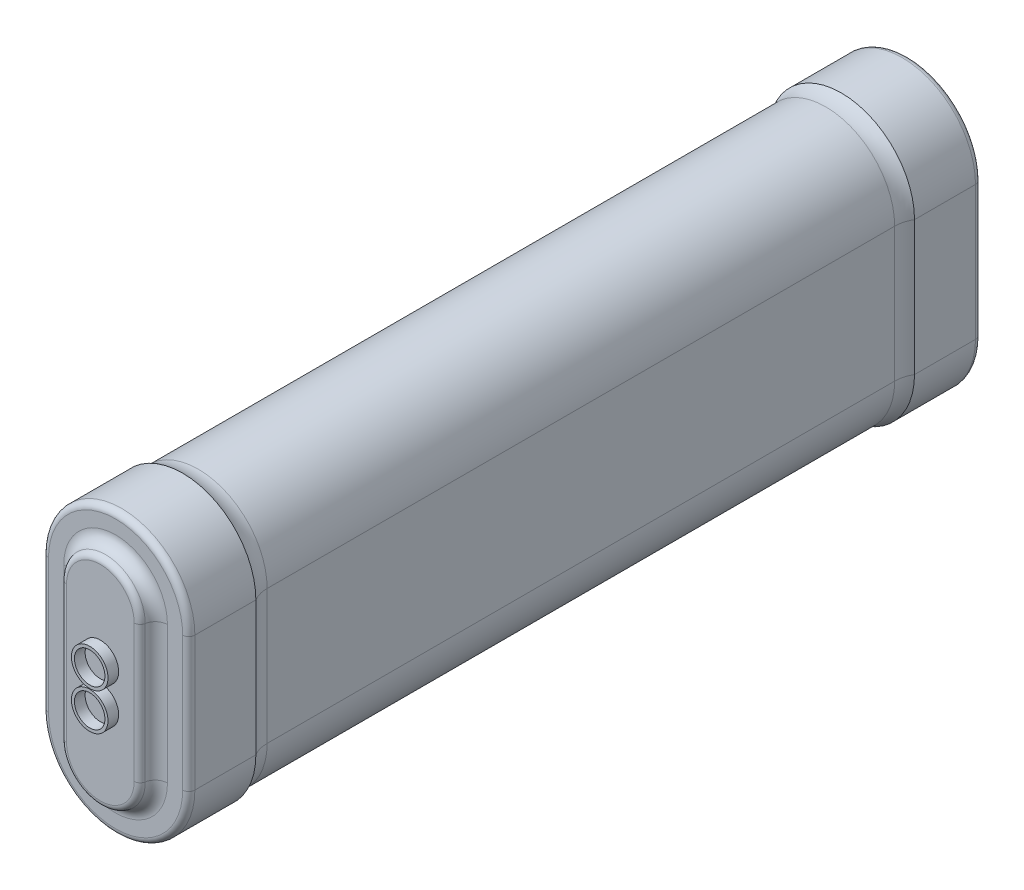
from build123d import *

# Parameters (mm, degrees)
BOSS_EXTRUDE2_DEPTH = 65
CUT_EXTRUDE1_DEPTH  = 54
FILLET1_R           = 5
FILLET2_R           = 1
BOSS_EXTRUDE3_DEPTH = 2.5
FILLET4_R           = 2
FILLET5_R           = 1
SKETCH4_R           = 3
SKETCH4_R_2         = 2.5
BOSS_EXTRUDE8_DEPTH = 1.75


with BuildPart() as part:
    # Sketch1 → Boss-Extrude2 (new, symmetric)
    with BuildSketch(Plane.XY):
        with BuildLine():
            Line((-12, -11), (-12, 11))
            ThreePointArc((-12, 11), (0, 23), (12, 11))
            Line((12, 11), (12, -11))
            ThreePointArc((12, -11), (0, -23), (-12, -11))
        make_face()
    extrude(amount=BOSS_EXTRUDE2_DEPTH, both=True)

    # Sketch2 → Cut-Extrude1 (cut, symmetric)
    with BuildSketch(Plane.XY):
        with BuildLine():
            Line((15, 11), (15, -11))
            ThreePointArc((15, -11), (0, -26), (-15, -11))
            Line((-15, -11), (-15, 11))
            ThreePointArc((-15, 11), (0, 26), (15, 11))
        make_face()
        with BuildLine():
            Line((-11.3, 11), (-11.3, -11))
            ThreePointArc((-11.3, -11), (0, -22.3), (11.3, -11))
            Line((11.3, -11), (11.3, 11))
            ThreePointArc((11.3, 11), (0, 22.3), (-11.3, 11))
        make_face(mode=Mode.SUBTRACT)
    extrude(amount=CUT_EXTRUDE1_DEPTH, both=True, mode=Mode.SUBTRACT)

    # Fillet1
    # the kernel refuses this fillet: 5 mm, written as the material it adds along each edge
    with BuildSketch(Plane(origin=(0, 11, -54), x_dir=(1, 0, 0), z_dir=(0, -1, 0))) as fillet1_piece_1:
        with BuildLine():
            CenterArc((16.3, 2.551470164), FILLET1_R, 180, 30.683417109)
            Line((11.3, 2.551470164), (11.2, 2.551470164))
            Line((11.2, 2.551470164), (11.2, 0))
            Line((11.2, 0), (11.3, -0.1))
            ThreePointArc((11.3, -0.1), (11.65, -0.1), (11.914, -0.051029403))
            Line((11.914, -0.051029403), (12, 0))
        make_face()
    revolve(axis=Axis((0, 11, -54), (0, 0, 1)), revolution_arc=180)
    with BuildSketch(Plane(origin=(-11.3, 11, -54), x_dir=(-1, 0, 0), z_dir=(0, -1, 0)), Plane(origin=(11.3, -11, -54), x_dir=(1, 0, 0), z_dir=(0, 1, 0))) as fillet1_piece_2:
        with BuildLine():
            CenterArc((5, -2.551470164), FILLET1_R, 149.316582891, 30.683417109)
            Line((0, -2.551470164), (-0.1, -2.551470164))
            Line((-0.1, -2.551470164), (-0.1, 0))
            Line((-0.1, 0), (0, 0.1))
            ThreePointArc((0, 0.1), (0.35, 0.1), (0.614, 0.051029403))
            Line((0.614, 0.051029403), (0.7, 0))
        make_face()
    extrude(amount=22)
    with BuildSketch(Plane(origin=(0, -11, -54), x_dir=(-1, 0, 0), z_dir=(0, 1, 0))) as fillet1_piece_3:
        with BuildLine():
            CenterArc((16.3, 2.551470164), FILLET1_R, 180, 30.683417109)
            Line((11.3, 2.551470164), (11.2, 2.551470164))
            Line((11.2, 2.551470164), (11.2, 0))
            Line((11.2, 0), (11.3, -0.1))
            ThreePointArc((11.3, -0.1), (11.65, -0.1), (11.914, -0.051029403))
            Line((11.914, -0.051029403), (12, 0))
        make_face()
    revolve(axis=Axis((0, -11, -54), (0, 0, 1)), revolution_arc=180)
    with BuildSketch(Plane(origin=(0, 11, 54), x_dir=(1, 0, 0), z_dir=(0, -1, 0))) as fillet1_piece_4:
        with BuildLine():
            CenterArc((16.3, -2.551470164), FILLET1_R, 149.316582891, 30.683417109)
            Line((12, 0), (11.914, 0.051029403))
            ThreePointArc((11.914, 0.051029403), (11.65, 0.1), (11.3, 0.1))
            Line((11.3, 0.1), (11.2, 0))
            Line((11.2, 0), (11.2, -2.551470164))
            Line((11.2, -2.551470164), (11.3, -2.551470164))
        make_face()
    revolve(axis=Axis((0, 11, 54), (0, 0, 1)), revolution_arc=180)
    with BuildSketch(Plane(origin=(11.3, -11, 54), x_dir=(0, 0, -1), z_dir=(0, 1, 0)), Plane(origin=(-11.3, 11, 54), x_dir=(0, 0, -1), z_dir=(0, -1, 0))) as fillet1_piece_5:
        with BuildLine():
            CenterArc((2.551470164, -5), FILLET1_R, 90, 30.683417109)
            Line((0, -0.7), (-0.051029403, -0.614))
            ThreePointArc((-0.051029403, -0.614), (-0.1, -0.35), (-0.1, 0))
            Line((-0.1, 0), (0, 0.1))
            Line((0, 0.1), (2.551470164, 0.1))
            Line((2.551470164, 0.1), (2.551470164, 0))
        make_face()
    extrude(amount=22)
    with BuildSketch(Plane(origin=(0, -11, 54), x_dir=(-1, 0, 0), z_dir=(0, 1, 0))) as fillet1_piece_6:
        with BuildLine():
            CenterArc((16.3, -2.551470164), FILLET1_R, 149.316582891, 30.683417109)
            Line((12, 0), (11.914, 0.051029403))
            ThreePointArc((11.914, 0.051029403), (11.65, 0.1), (11.3, 0.1))
            Line((11.3, 0.1), (11.2, 0))
            Line((11.2, 0), (11.2, -2.551470164))
            Line((11.2, -2.551470164), (11.3, -2.551470164))
        make_face()
    revolve(axis=Axis((0, -11, 54), (0, 0, 1)), revolution_arc=180)

    # Fillet2
    fillet2_edges = [part.edges().sort_by_distance(p)[0] for p in [
        (0, 23, 65),
        (-12, 0, 65),
        (0, -23, 65),
        (-12, 0, -65),
        (0, 23, -65),
        (12, 0, -65),
        (0, -23, -65),
        (12, 0, 65),
    ]]
    fillet(fillet2_edges, radius=FILLET2_R)

    # Sketch3 → Boss-Extrude3 (add)
    with BuildSketch(Plane.XY.offset(65)):
        with BuildLine():
            Line((-6.5, -11.25), (-6.5, 11.25))
            ThreePointArc((-6.5, 11.25), (0, 17.75), (6.5, 11.25))
            Line((6.5, 11.25), (6.5, -11.25))
            ThreePointArc((6.5, -11.25), (0, -17.75), (-6.5, -11.25))
        make_face()
    extrude(amount=BOSS_EXTRUDE3_DEPTH)

    # Fillet4
    fillet4_edges = [part.edges().sort_by_distance(p)[0] for p in [
        (0, -17.75, 65),
        (6.5, 0, 65),
        (0, 17.75, 65),
        (-6.5, 0, 65),
    ]]
    fillet(fillet4_edges, radius=FILLET4_R)

    # Fillet5
    # the kernel refuses this fillet: 1 mm, written as the material it takes off along each edge
    with BuildSketch(Plane(origin=(-6.5, -11.25, 67.5), x_dir=(-0.03354919019221856, 0, -0.9994370674722076), z_dir=(0, 1, 0)), Plane(origin=(6.5, 11.25, 67.5), x_dir=(0.03354919019221963, 0, -0.9994370674722076), z_dir=(0, -1, 0))) as fillet5_piece_1:
        with BuildLine():
            CenterArc((0.967295605, -0.99104977), FILLET5_R, 97.671480447, 80.405931773)
            Line((-0.032141463, -0.95750058), (-0.132085169, -0.954145661))
            Line((-0.132085169, -0.954145661), (-0.099943707, 0.003354919))
            Line((-0.099943707, 0.003354919), (0.003354919, 0.099943707))
            ThreePointArc((0.003354919, 0.099943707), (0.503073453, 0.083169112), (0.820453418, 0.099104977))
            Line((0.820453418, 0.099104977), (0.833802708, 0))
        make_face()
    extrude(amount=22.5, mode=Mode.SUBTRACT)
    with BuildSketch(Plane(origin=(0, 11.25, 67.5), x_dir=(-1, 0, 0), z_dir=(0, -1, 0))) as fillet5_piece_2:
        with BuildLine():
            CenterArc((5.541960108, 1), FILLET5_R, 270, 80.405931773)
            Line((5.541960108, 0), (5.541960108, -0.1))
            Line((5.541960108, -0.1), (6.5, -0.1))
            Line((6.5, -0.1), (6.6, 0))
            ThreePointArc((6.6, 0), (6.6, 0.5), (6.626574735, 0.816666667))
            Line((6.626574735, 0.816666667), (6.527973406, 0.833333333))
        make_face()
    revolve(axis=Axis((0, 11.25, 67.5), (0, 0, -1)), revolution_arc=180, mode=Mode.SUBTRACT)
    with BuildSketch(Plane(origin=(0, -11.25, 67.5), x_dir=(1, 0, 0), z_dir=(0, 1, 0))) as fillet5_piece_3:
        with BuildLine():
            CenterArc((5.541960108, 1), FILLET5_R, 270, 80.405931773)
            Line((5.541960108, 0), (5.541960108, -0.1))
            Line((5.541960108, -0.1), (6.5, -0.1))
            Line((6.5, -0.1), (6.6, 0))
            ThreePointArc((6.6, 0), (6.6, 0.5), (6.626574735, 0.816666667))
            Line((6.626574735, 0.816666667), (6.527973406, 0.833333333))
        make_face()
    revolve(axis=Axis((0, -11.25, 67.5), (0, 0, -1)), revolution_arc=180, mode=Mode.SUBTRACT)

    # Sketch4 → Boss-Extrude8 (add)
    # profile 1 of 2: a face of its own
    with BuildSketch(Plane.XY.offset(67.5)):
        with Locations(Location((0, 3.05, 0), (0, 0, 180))):
            Circle(SKETCH4_R)
        with Locations((0, 3.05)):
            Circle(SKETCH4_R_2, mode=Mode.SUBTRACT)
    # profile 2 of 2: a face of its own
    with BuildSketch(Plane.XY.offset(67.5)):
        with Locations(Location((0, -3.05, 0), (0, 0, 180))):
            Circle(SKETCH4_R)
        with Locations((0, -3.05)):
            Circle(SKETCH4_R_2, mode=Mode.SUBTRACT)
    extrude(amount=BOSS_EXTRUDE8_DEPTH)


solid = part.part
